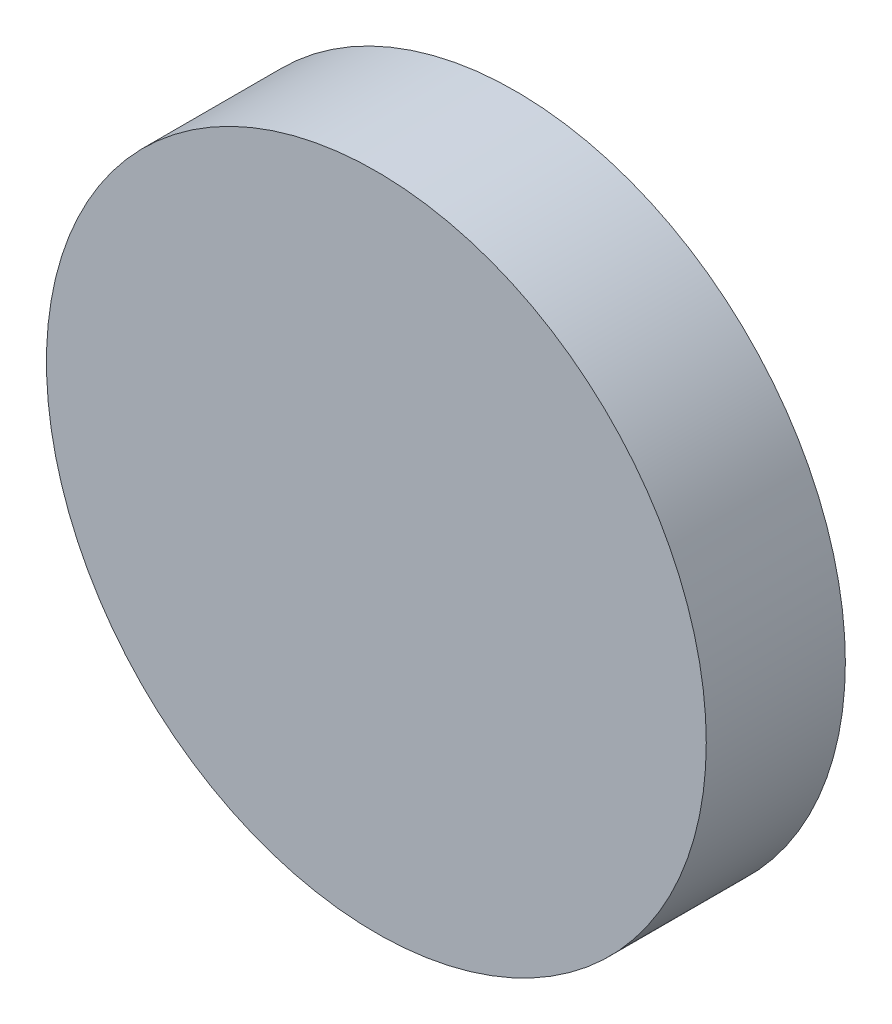
from build123d import *

# Parameters (mm, degrees)
SKETCH1_R           = 1.778
BOSS_EXTRUDE1_DEPTH = 2.54
FILLET1_R           = 2.54
BOSS_EXTRUDE2_START = -15.24
SKETCH3_R           = 42.173631202
SKETCH3_R_2         = 38.557688222
SKETCH3_R_3         = 1.778
BOSS_EXTRUDE2_DEPTH = 15.24
SKETCH4_R           = 42.173631202
BOSS_EXTRUDE3_DEPTH = 2.54


with BuildPart() as part:
    # Sketch1 → Boss-Extrude1 (new, symmetric)
    with BuildSketch(Plane.XY):
        with BuildLine():
            ThreePointArc((23.096897519, 13.335), (18.163878776, 19.528502447), (11.629866574, 24.000731311))
            add(Edge.make_bspline(
                [(12.942718979, 26.367649013), (12.489890773, 26.524403161), (10.214611, 26.823602727), (8.514999239, 25.805149786), (11.629866574, 24.000731311)],
                knots=[0.119187678, 0.119187678, 0.119187678, 0.119187678, 0.354139338, 1, 1, 1, 1], degree=3))
            ThreePointArc((12.942718979, 26.367649013), (14.594299506, 26.395047723), (14.579783558, 28.046791715))
            ThreePointArc((14.579783558, 28.046791715), (0, 32.207688222), (-14.579783558, 28.046791715))
            ThreePointArc((-14.579783558, 28.046791715), (-14.594299506, 26.395047723), (-12.942718979, 26.367649013))
            add(Edge.make_bspline(
                [(-12.942718979, 26.367649013), (-12.489890773, 26.524403161), (-10.214611, 26.823602727), (-8.514999239, 25.805149786), (-11.629866574, 24.000731311)],
                knots=[0.119187678, 0.119187678, 0.119187678, 0.119187678, 0.354139338, 1, 1, 1, 1], degree=3))
            ThreePointArc((-11.629866574, 24.000731311), (-18.163878776, 19.528502447), (-23.096897519, 13.335))
            ThreePointArc((-23.096897519, 13.335), (-23.564242622, 12.49061126), (-24.000731311, 11.629866574))
            add(Edge.make_bspline(
                [(-26.367649013, 12.942718979), (-26.524403161, 12.489890773), (-26.823602727, 10.214611), (-25.805149786, 8.514999239), (-24.000731311, 11.629866574)],
                knots=[0.119187678, 0.119187678, 0.119187678, 0.119187678, 0.354139338, 1, 1, 1, 1], degree=3))
            ThreePointArc((-26.367649013, 12.942718979), (-26.395047723, 14.594299506), (-28.046791715, 14.579783558))
            ThreePointArc((-28.046791715, 14.579783558), (-32.207688222, 0), (-28.046791715, -14.579783558))
            ThreePointArc((-28.046791715, -14.579783558), (-26.395047723, -14.594299506), (-26.367649013, -12.942718979))
            add(Edge.make_bspline(
                [(-26.367649013, -12.942718979), (-26.524403161, -12.489890773), (-26.823602727, -10.214611), (-25.805149786, -8.514999239), (-24.000731311, -11.629866574)],
                knots=[0.119187678, 0.119187678, 0.119187678, 0.119187678, 0.354139338, 1, 1, 1, 1], degree=3))
            ThreePointArc((-24.000731311, -11.629866574), (-18.858537854, -18.858537854), (-11.629866574, -24.000731311))
            add(Edge.make_bspline(
                [(-12.942718979, -26.367649013), (-12.489890773, -26.524403161), (-10.214611, -26.823602727), (-8.514999239, -25.805149786), (-11.629866574, -24.000731311)],
                knots=[0.119187678, 0.119187678, 0.119187678, 0.119187678, 0.354139338, 1, 1, 1, 1], degree=3))
            ThreePointArc((-12.942718979, -26.367649013), (-14.594299506, -26.395047723), (-14.579783558, -28.046791715))
            ThreePointArc((-14.579783558, -28.046791715), (0, -32.207688222), (14.579783558, -28.046791715))
            ThreePointArc((14.579783558, -28.046791715), (14.594299506, -26.395047723), (12.942718979, -26.367649013))
            add(Edge.make_bspline(
                [(12.942718979, -26.367649013), (12.489890773, -26.524403161), (10.214611, -26.823602727), (8.514999239, -25.805149786), (11.629866574, -24.000731311)],
                knots=[0.119187678, 0.119187678, 0.119187678, 0.119187678, 0.354139338, 1, 1, 1, 1], degree=3))
            ThreePointArc((11.629866574, -24.000731311), (18.858537854, -18.858537854), (24.000731311, -11.629866574))
            add(Edge.make_bspline(
                [(26.367649013, -12.942718979), (26.524403161, -12.489890773), (26.823602727, -10.214611), (25.805149786, -8.514999239), (24.000731311, -11.629866574)],
                knots=[0.119187678, 0.119187678, 0.119187678, 0.119187678, 0.354139338, 1, 1, 1, 1], degree=3))
            ThreePointArc((26.367649013, -12.942718979), (26.395047723, -14.594299506), (28.046791715, -14.579783558))
            ThreePointArc((28.046791715, -14.579783558), (32.207688222, 0), (28.046791715, 14.579783558))
            ThreePointArc((28.046791715, 14.579783558), (26.395047723, 14.594299506), (26.367649013, 12.942718979))
            add(Edge.make_bspline(
                [(26.367649013, 12.942718979), (26.524403161, 12.489890773), (26.823602727, 10.214611), (25.805149786, 8.514999239), (24.000731311, 11.629866574)],
                knots=[0.119187678, 0.119187678, 0.119187678, 0.119187678, 0.354139338, 1, 1, 1, 1], degree=3))
            ThreePointArc((24.000731311, 11.629866574), (23.564242622, 12.49061126), (23.096897519, 13.335))
        make_face()
        with Locations((0, 17.78)):
            Circle(SKETCH1_R, mode=Mode.SUBTRACT)
        with Locations((15.397931679, -8.89)):
            Circle(SKETCH1_R, mode=Mode.SUBTRACT)
        with Locations((-15.397931679, -8.89)):
            Circle(SKETCH1_R, mode=Mode.SUBTRACT)
        with BuildLine():
            Line((-4.28625, 20.274952091), (-4.28625, 22.454568821))
            ThreePointArc((-4.28625, 22.454568821), (-13.24349331, 18.633021359), (-19.797340731, 11.43))
            ThreePointArc((-19.797340731, 11.43), (-22.758416501, 2.152690962), (-21.58935203, -7.515283024))
            Line((-21.58935203, -7.515283024), (-17.877685951, -4.59493961))
            ThreePointArc((-17.877685951, -4.59493961), (-10.605148477, -7.614870918), (-15.415498572, -13.849477433))
            Line((-15.415498572, -13.849477433), (-17.30310203, -14.939285797))
            ThreePointArc((-17.30310203, -14.939285797), (-9.514923191, -20.78571232), (0, -22.86))
            ThreePointArc((0, -22.86), (9.514923191, -20.78571232), (17.30310203, -14.939285797))
            Line((17.30310203, -14.939285797), (12.918177407, -13.18506039))
            ThreePointArc((12.918177407, -13.18506039), (11.8972459, -5.376892533), (19.701748572, -6.425474659))
            Line((19.701748572, -6.425474659), (21.58935203, -7.515283024))
            ThreePointArc((21.58935203, -7.515283024), (22.758416501, 2.152690962), (19.797340731, 11.43))
            ThreePointArc((19.797340731, 11.43), (13.24349331, 18.633021359), (4.28625, 22.454568821))
            Line((4.28625, 22.454568821), (4.959508544, 17.78))
            ThreePointArc((4.959508544, 17.78), (-1.292097423, 12.991763451), (-4.28625, 20.274952091))
        make_face(mode=Mode.SUBTRACT)
    extrude(amount=BOSS_EXTRUDE1_DEPTH, both=True)

    # Fillet1
    # the kernel refuses this fillet: 2.54 mm, written as the material it adds along each edge
    with BuildSketch(Plane(origin=(21.58935203, -7.515283024, 0), x_dir=(-0.8660254037844372, 0.5000000000000026, 0), z_dir=(0, 0, -1)), Plane(origin=(-17.30310203, -14.939285797, 0), x_dir=(0.8660254037844382, 0.5000000000000008, 0), z_dir=(0, 0, -1)), Plane(origin=(-4.28625, 22.454568821, 0), x_dir=(0, -1, 0), z_dir=(0, 0, -1))) as fillet1_piece_1:
        with BuildLine():
            CenterArc((3.235105636, 2.310312353), FILLET1_R, 161.0565991, 84.38964425)
            Line((0.832672738, 3.134882647), (0.78462408, 3.151374053))
            ThreePointArc((0.78462408, 3.151374053), (0.311567983, 1.595269408), (-0.049899042, 0.009525))
            Line((-0.049899042, 0.009525), (0, -0.0508))
            ThreePointArc((0, -0.0508), (1.089808365, -0.0508), (2.158506952, -0.046206247))
            Line((2.158506952, -0.046206247), (2.17961673, 0))
        make_face()
    extrude(amount=2.54)
    with BuildSketch(Plane(origin=(17.30310203, -14.939285797, 0), x_dir=(-0.7195709341275718, -0.6944189447003685, 0), z_dir=(0, 0, -1)), Plane(origin=(4.28625, 22.454568821, 0), x_dir=(0.9611699140434871, -0.2759572364291899, 0), z_dir=(0, 0, -1)), Plane(origin=(-21.58935203, -7.515283024, 0), x_dir=(-0.24159897991591575, 0.9703761811295601, 0), z_dir=(0, 0, -1))) as fillet1_piece_2:
        with BuildLine():
            CenterArc((3.922629513, 2.529497521), FILLET1_R, 155.785220789, 119.426923656)
            Line((1.60611307, 3.571299597), (1.559782741, 3.592135639))
            Line((1.559782741, 3.592135639), (-0.046330329, 0.020836042))
            Line((-0.046330329, 0.020836042), (-0.004614858, -0.05058995))
            ThreePointArc((-0.004614858, -0.05058995), (2.076686213, -0.145322312), (4.157987284, -0.05058995))
            Line((4.157987284, -0.05058995), (4.153372426, 0))
        make_face()
    extrude(amount=2.54)
    with BuildSketch(Plane(origin=(-21.58935203, -7.515283024, 0), x_dir=(-0.24159897991591575, 0.9703761811295601, 0), z_dir=(0, 0, 1)), Plane(origin=(4.28625, 22.454568821, 0), x_dir=(0.9611699140434871, -0.2759572364291899, 0), z_dir=(0, 0, 1)), Plane(origin=(17.30310203, -14.939285797, 0), x_dir=(-0.7195709341275718, -0.6944189447003685, 0), z_dir=(0, 0, 1))) as fillet1_piece_3:
        with BuildLine():
            CenterArc((3.922629513, -2.529497521), FILLET1_R, 84.787855555, 119.426923656)
            Line((1.60611307, -3.571299597), (1.559782741, -3.592135639))
            Line((1.559782741, -3.592135639), (-0.046330329, -0.020836042))
            Line((-0.046330329, -0.020836042), (-0.004614858, 0.05058995))
            ThreePointArc((-0.004614858, 0.05058995), (2.076686213, 0.145322312), (4.157987284, 0.05058995))
            Line((4.157987284, 0.05058995), (4.153372426, 0))
        make_face()
    extrude(amount=2.54)
    with BuildSketch(Plane(origin=(-4.28625, 22.454568821, 0), x_dir=(0, -1, 0), z_dir=(0, 0, 1)), Plane(origin=(-17.30310203, -14.939285797, 0), x_dir=(0.8660254037844382, 0.5000000000000008, 0), z_dir=(0, 0, 1)), Plane(origin=(21.58935203, -7.515283024, 0), x_dir=(-0.8660254037844372, 0.5000000000000026, 0), z_dir=(0, 0, 1))) as fillet1_piece_4:
        with BuildLine():
            CenterArc((3.235105636, -2.310312353), FILLET1_R, 114.55375665, 84.38964425)
            Line((0.832672738, -3.134882647), (0.78462408, -3.151374053))
            ThreePointArc((0.78462408, -3.151374053), (0.311567983, -1.595269408), (-0.049899042, -0.009525))
            Line((-0.049899042, -0.009525), (0, 0.0508))
            ThreePointArc((0, 0.0508), (1.089808365, 0.0508), (2.158506952, 0.046206247))
            Line((2.158506952, 0.046206247), (2.17961673, 0))
        make_face()
    extrude(amount=2.54)

    # Sketch3 → Boss-Extrude2 (add)
    # profile 1 of 4: a face of its own
    with BuildSketch(Plane.XY.offset(2.54).offset(BOSS_EXTRUDE2_START)):
        Circle(SKETCH3_R)
        Circle(SKETCH3_R_2, mode=Mode.SUBTRACT)
    # profile 2 of 4: a face of its own
    with BuildSketch(Plane.XY.offset(2.54).offset(BOSS_EXTRUDE2_START)):
        with Locations((15.397931679, -8.89)):
            Circle(SKETCH3_R_3)
    # profile 3 of 4: a face of its own
    with BuildSketch(Plane.XY.offset(2.54).offset(BOSS_EXTRUDE2_START)):
        with Locations((-15.397931679, -8.89)):
            Circle(SKETCH3_R_3)
    # profile 4 of 4: a face of its own
    with BuildSketch(Plane.XY.offset(2.54).offset(BOSS_EXTRUDE2_START)):
        with Locations((0, 17.78)):
            Circle(SKETCH3_R_3)
    extrude(amount=BOSS_EXTRUDE2_DEPTH)


with BuildPart() as boss_extrude2_piece_1:
    # of the separate pieces the step leaves, piece 1, a body of its own (boss_extrude2_pieces)
    add(part.part.solids().sort_by_distance((42.173631202, 0, -12.7))[0])



with BuildPart() as boss_extrude2_piece_2:
    # of the separate pieces the step leaves, piece 2, a body of its own (boss_extrude2_pieces)
    add(part.part.solids().sort_by_distance((-18.511883244, -5.093926817, -2.54))[0])


with BuildPart() as boss_extrude2_piece_1_1:
    add(boss_extrude2_piece_1.part)

    add(boss_extrude2_piece_2.part)  # Boss-Extrude3 merges Boss-Extrude2 piece 2
    # Sketch4 → Boss-Extrude3 (add)
    with BuildSketch(Plane.XY.offset(2.54)):
        Circle(SKETCH4_R)
    extrude(amount=BOSS_EXTRUDE3_DEPTH)


solid = boss_extrude2_piece_1_1.part
